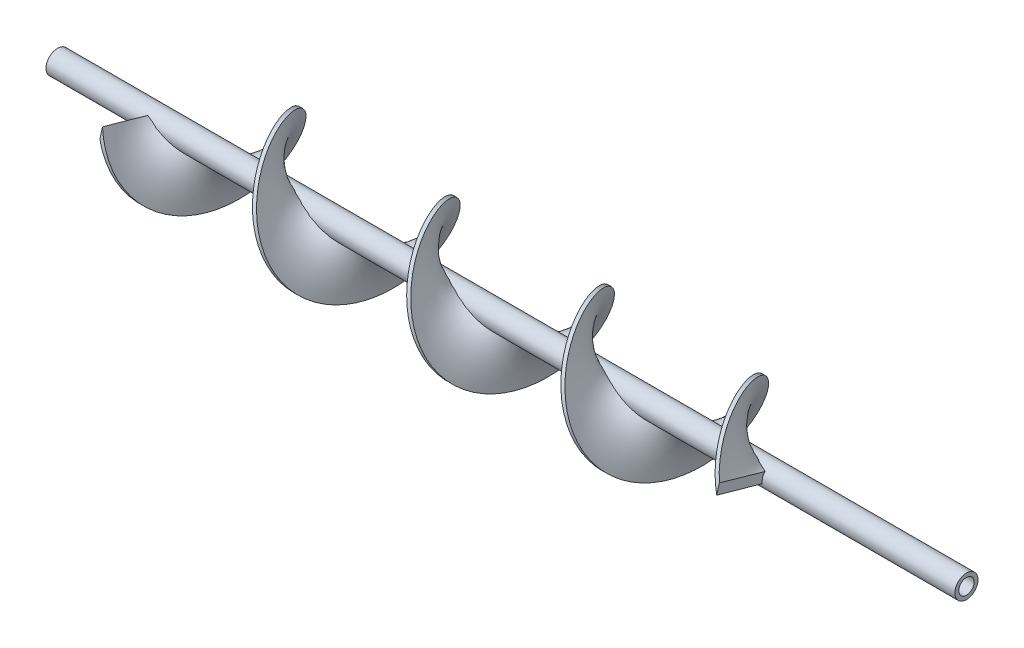
from build123d import *

# Parameters (mm, degrees)
AUFSATZ_LINEAR_AUSTRAGEN1_DEPTH      = 51.5
AUFSATZ_LINEAR_AUSTRAGEN1_DEPTH_BACK = 415
SKIZZE3_R                            = 6
SKIZZE3_R_2                          = 4
AUSTRAGUNG1_PITCH                    = 80
AUSTRAGUNG1_HEIGHT                   = 320
AUSTRAGUNG1_RADIUS                   = 4
SKETCH1_R                            = 6
SKETCH1_R_2                          = 4
BOSS_EXTRUDE1_DEPTH                  = 65
SKETCH2_R                            = 6
CUT_EXTRUDE1_DEPTH                   = 80
SKETCH3_R                            = 6
SKETCH3_R_2                          = 4
BOSS_EXTRUDE2_DEPTH                  = 20


with BuildPart() as part:
    # Skizze3 → Aufsatz-Linear austragen1 (new, two sides: drawn at the far end of the back side and taken through both)
    with BuildSketch(Plane(origin=(0, 0, 0), x_dir=(0, 0, -1), z_dir=(1, 0, 0)).offset(-AUFSATZ_LINEAR_AUSTRAGEN1_DEPTH_BACK)):
        Circle(SKIZZE3_R)
        Circle(SKIZZE3_R_2, mode=Mode.SUBTRACT)
    extrude(amount=AUFSATZ_LINEAR_AUSTRAGEN1_DEPTH + AUFSATZ_LINEAR_AUSTRAGEN1_DEPTH_BACK)

    # Sketch1 → Boss-Extrude1 (add)
    with BuildSketch(Plane(origin=(51.5, 0, 0), x_dir=(0, 0, -1), z_dir=(1, 0, 0))):
        Circle(SKETCH1_R)
        Circle(SKETCH1_R_2, mode=Mode.SUBTRACT)
    extrude(amount=BOSS_EXTRUDE1_DEPTH)

    # Sketch2 → Cut-Extrude1 (cut)
    with BuildSketch(Plane.ZY.offset(415)):
        Circle(SKETCH2_R)
    extrude(amount=-CUT_EXTRUDE1_DEPTH, mode=Mode.SUBTRACT)

    # Sketch3 → Boss-Extrude2 (add)
    with BuildSketch(Plane(origin=(116.5, 0, 0), x_dir=(0, 0, -1), z_dir=(1, 0, 0))):
        Circle(SKETCH3_R)
        Circle(SKETCH3_R_2, mode=Mode.SUBTRACT)
    extrude(amount=BOSS_EXTRUDE2_DEPTH)


with BuildPart() as body_2:
    # Austragung1: sweep along a helix
    with BuildLine() as austragung1_path:
        Helix(AUSTRAGUNG1_PITCH, AUSTRAGUNG1_HEIGHT, AUSTRAGUNG1_RADIUS, center=(36.5, 0, 0), direction=(-1, 0, 0))
    # Skizze2 → Austragung1 (sweep)
    with BuildSketch(Plane(origin=(0, 0, 0), x_dir=(0, 0, -1), z_dir=(1, 0, 0))):
        with BuildLine():
            Line((3.122498999, -2.5), (30, -2.5))
            Line((30, -2.5), (30, 2.5))
            Line((30, 2.5), (3.122498999, 2.5))
            ThreePointArc((3.122498999, 2.5), (4, 0), (3.122498999, -2.5))
        make_face()
    sweep(path=austragung1_path.line, is_frenet=True)


solid = Compound([part.part, body_2.part])
